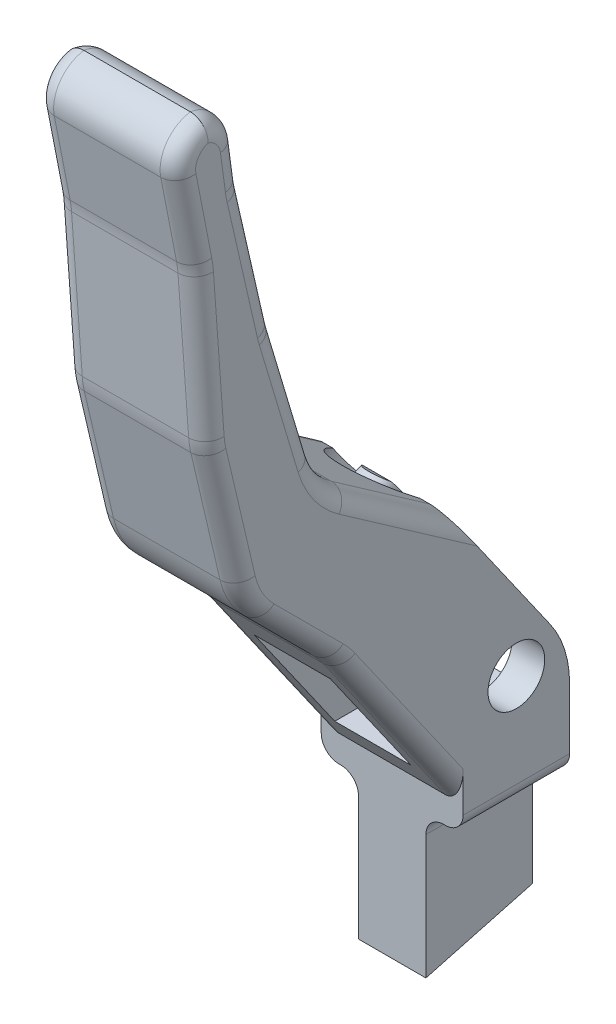
from build123d import *

# Parameters (mm, degrees)
BOSS_EXTRUDE1_DEPTH            = 4
BOSS_EXTRUDE1_DEPTH_BACK       = 4
CUT_EXTRUDE1_DEPTH             = 41.91630483998618
CUT_EXTRUDE1_DEPTH_BACK        = 41.91630483998618
SKETCH2_W                      = 4.3
SKETCH2_H                      = 6.500000000000001
CUT_EXTRUDE2_DEPTH             = 41.91630483998618
CUT_EXTRUDE2_DEPTH_BACK        = 41.91630483998618
SKETCH3_R                      = 1.6
FILLET1_R                      = 6
SKETCH4_W                      = 2.1
SKETCH4_H                      = 6
CUT_EXTRUDE3_DEPTH             = 8
CHAMFER1_SIZE2                 = 6
CHAMFER1_SIZE                  = 1.607695155
CUT_EXTRUDE4_REACH             = 42.961
SKETCH5_R                      = 2.5000000000000013
SKETCH5_R_2                    = 1.0000000000000007
CUT_EXTRUDE4_DIRECTION_2_DEPTH = 2
FILLET2_R                      = 0.5
FILLET4_R                      = 5
FILLET5_R                      = 2
FILLET3_R                      = 1
FILLET6_R                      = 1


# Some blends are built 0.0001 mm under size
with BuildPart() as part:
    # Sketch1 → Boss-Extrude1 (new, two sides: drawn at the far end of the back side and taken through both)
    with BuildSketch(Plane(origin=(0, 0, 0), x_dir=(0, 0, -1), z_dir=(1, 0, 0)).offset(-BOSS_EXTRUDE1_DEPTH_BACK)):
        Polygon((-3.000000000000001, -4.800000000000001), (-3, -14.3), (3, -14.3), (3.0000000000000027, 0), (-3.8829172362125313, 9.829824531467917), (-10.84570961266894, 14.70522424045184), (-13.58193115320061, 23.844215950393988), (-15.378428238466466, 31.705141587860197), (-15.919640758594626, 35.74219326392616), (-19.50998776121677, 35.742193263926154), (-18.095633132633182, 28.500528392334523), (-17.441484730828904, 19.459007101196175), (-15.378428238466466, 10.64578329548253), (-10.164239956075727, 5.43159501309181), align=None)
    extrude(amount=BOSS_EXTRUDE1_DEPTH + BOSS_EXTRUDE1_DEPTH_BACK)

    # Sketch2 → Cut-Extrude1 (cut, two sides: drawn at the far end of the back side and taken through both)
    with BuildSketch(Plane.XY.offset(-CUT_EXTRUDE1_DEPTH_BACK)):
        Rectangle(SKETCH2_W, SKETCH2_H)
    extrude(amount=CUT_EXTRUDE1_DEPTH + CUT_EXTRUDE1_DEPTH_BACK, mode=Mode.SUBTRACT)

    # Sketch3 → Cut-Extrude2 (cut, two sides: drawn at the far end of the back side and taken through both)
    with BuildSketch(Plane(origin=(0, 0, 0), x_dir=(0, 0, -1), z_dir=(1, 0, 0)).offset(-CUT_EXTRUDE2_DEPTH_BACK)):
        Circle(SKETCH3_R)
    extrude(amount=CUT_EXTRUDE2_DEPTH + CUT_EXTRUDE2_DEPTH_BACK, mode=Mode.SUBTRACT)

    # Fillet1
    fillet1_edges = [part.edges().sort_by_distance(p)[0] for p in [
        (-3.0749999999999997, 0, -3.0000000000000027),
        (3.075, 0, -3.0000000000000027),
    ]]
    fillet(fillet1_edges, radius=FILLET1_R)

    # Sketch4 → Cut-Extrude3 (cut)
    with BuildSketch(Plane.XZ.offset(14.3)):
        with Locations((-2.95, 0)):
            Rectangle(SKETCH4_W, SKETCH4_H)
        with Locations((2.95, 0)):
            Rectangle(SKETCH4_W, SKETCH4_H)
    extrude(amount=-CUT_EXTRUDE3_DEPTH, mode=Mode.SUBTRACT)

    # Chamfer1
    chamfer1_edges = [part.edges().sort_by_distance(p)[0] for p in [
        (0, -14.3, -3),
    ]]
    chamfer1_side = [part.faces().sort_by_distance(p)[0] for p in [
        (0, -14.267846096908267, -3),
    ]]
    chamfer(chamfer1_edges, length=CHAMFER1_SIZE - 0.0001, length2=CHAMFER1_SIZE2 - 0.0001, reference=chamfer1_side[0])  # a hair under: the kernel refuses the full size

    # Sketch5 → Cut-Extrude4 (cut, up to next)
    with BuildSketch(Plane(origin=(0, 0.10019833493160003, -0.27529266269151886), x_dir=(1, 0, 0), z_dir=(0, -0.34202014332567265, 0.939692620785907)), mode=Mode.PRIVATE) as cut_extrude4_sk1:
        with Locations(Location((0, 10, 0), (0, 0, 13.062852968))):
            Circle(SKETCH5_R)
        with Locations(Location((0, 10, 0), (0, 0, 34.405727741))):
            Circle(SKETCH5_R_2, mode=Mode.SUBTRACT)
    cut_extrude4_tool1 = extrude(cut_extrude4_sk1.sketch, amount=-CUT_EXTRUDE4_REACH, mode=Mode.PRIVATE) & part.part
    add(cut_extrude4_tool1.solids().sort_by_distance((-2.366426, 8.98117, 2.957117))[0], mode=Mode.SUBTRACT)

    # Sketch5 → Cut-Extrude4 direction 2 (cut)
    with BuildSketch(Plane(origin=(0, 0.10019833493160003, -0.27529266269151886), x_dir=(1, 0, 0), z_dir=(0, -0.34202014332567265, 0.939692620785907))):
        with Locations(Location((0, 10, 0), (0, 0, 13.062852968))):
            Circle(SKETCH5_R)
        with Locations(Location((0, 10, 0), (0, 0, 34.405727741))):
            Circle(SKETCH5_R_2, mode=Mode.SUBTRACT)
    extrude(amount=CUT_EXTRUDE4_DIRECTION_2_DEPTH, mode=Mode.SUBTRACT)

    # Fillet2
    fillet2_edges = [part.edges().sort_by_distance(p)[0] for p in [
        (4.4e-16, 3.25, -0.7243255008184559),
    ]]
    fillet(fillet2_edges, radius=FILLET2_R)

    # Fillet4
    # the kernel refuses this fillet: 5 mm, written as the material it adds along each edge
    with BuildSketch(Plane(origin=(4, 5.43159501309181, 10.164239956075727), x_dir=(0, 0.7071067811865465, 0.7071067811865486), z_dir=(-1, 0, 0))) as fillet4_piece_1:
        with BuildLine():
            CenterArc((FILLET4_R * 0.0874886635259, -FILLET4_R), FILLET4_R, 89.99999999999997, 10.000000000000199)
            Line((-FILLET4_R * 0.086159514141, -FILLET4_R * 0.0151922469878), (0, 0))
            Line((0, 0), (FILLET4_R * 0.0874886635259, 2e-17))
        make_face()
    extrude(amount=8)
    with BuildSketch(Plane(origin=(-4, 28.500528392334523, 18.095633132633182), x_dir=(0, 0.9814562655585333, 0.19168619876219029), z_dir=(1, 0, 0))) as fillet4_piece_2:
        with BuildLine():
            CenterArc((FILLET4_R * 0.0604014869533, FILLET4_R), FILLET4_R, 263.08689839308795, 6.913101606911994)
            Line((-FILLET4_R * 0.0599623587654, FILLET4_R * 0.00727015525684), (0, 0))
            Line((0, 0), (FILLET4_R * 0.0604014869533, -1e-17))
        make_face()
    extrude(amount=8)
    with BuildSketch(Plane(origin=(-4, 31.705141587860197, 15.378428238466466), x_dir=(0, -0.9748662082340892, -0.22279110404881375), z_dir=(1, 0, 0))) as fillet4_piece_3:
        with BuildLine():
            CenterArc((FILLET4_R * 0.0457367799451, FILLET4_R), FILLET4_R, 264.762601002661, 5.237398997338971)
            Line((-FILLET4_R * 0.0455458301397, FILLET4_R * 0.00417497265026), (0, 0))
            Line((0, 0), (FILLET4_R * 0.0457367799451, 0))
        make_face()
    extrude(amount=8)
    with BuildSketch(Plane(origin=(-4, 23.844215950393988, 13.58193115320061), x_dir=(0, -0.9579841255207325, -0.28682122524366543), z_dir=(1, 0, 0))) as fillet4_piece_4:
        with BuildLine():
            CenterArc((FILLET4_R * 0.0331273043115, FILLET4_R), FILLET4_R, 266.20527827895825, 3.794721721041242)
            Line((-FILLET4_R * 0.0330546749969, FILLET4_R * 0.00219243056848), (0, 0))
            Line((0, 0), (FILLET4_R * 0.0331273043115, 0))
        make_face()
    extrude(amount=8)
    with BuildSketch(Plane(origin=(-4, 14.70522424045184, 10.84570961266894), x_dir=(0, -0.5735764363510492, -0.8191520442889896), z_dir=(1, 0, 0))) as fillet4_piece_5:
        with BuildLine():
            CenterArc((FILLET4_R * 0.347574122955, FILLET4_R), FILLET4_R, 231.66774277351772, 38.332257226482284)
            Line((-FILLET4_R * 0.272646635616, FILLET4_R * 0.215572686199), (0, 0))
            Line((0, 0), (FILLET4_R * 0.347574122955, -7e-17))
        make_face()
    extrude(amount=8)
    # the kernel refuses this fillet: 5 mm, written as the material it takes off along each edge
    with BuildSketch(Plane(origin=(7.563674379485587, 10.64578329548253, 15.378428238466466), x_dir=(0, -0.7071067811865464, -0.7071067811865488), z_dir=(-1, 0, 0))) as fillet4_2_piece_1:
        with BuildLine():
            CenterArc((FILLET4_R * 0.285093950359, -FILLET4_R), FILLET4_R, 90.00000000000001, 31.825060763139305)
            Line((-FILLET4_R * 0.242233531689, -FILLET4_R * 0.15033787499), (0, 0))
            Line((0, 0), (FILLET4_R * 0.285093950359, -2e-17))
        make_face()
    extrude(amount=15.127348758971173, mode=Mode.SUBTRACT)
    with BuildSketch(Plane(origin=(-4.987814470464539, 19.459007101196175, 17.441484730828904), x_dir=(0, -0.973678688774351, -0.22792501184964434), z_dir=(1, 0, 0))) as fillet4_2_piece_2:
        with BuildLine():
            CenterArc((FILLET4_R * 0.0790251576372, FILLET4_R), FILLET4_R, 260.9631643644952, 9.036835635504929)
            Line((-FILLET4_R * 0.0780442629476, FILLET4_R * 0.0124124357217), (0, 0))
            Line((0, 0), (FILLET4_R * 0.0790251576372, 0))
        make_face()
    extrude(amount=9.975628940929077, mode=Mode.SUBTRACT)

    # Fillet5
    # the kernel refuses this fillet: 2 mm, written as the material it takes off along each edge
    with BuildSketch(Plane(origin=(-8.374424360751373, 35.74219326392616, 15.919640758594626), x_dir=(0, -0.9911331219582963, -0.1328726253116156), z_dir=(1, 0, 0))) as fillet5_piece_1:
        with BuildLine():
            CenterArc((FILLET5_R * 0.87488487215, -FILLET5_R), FILLET5_R, 90.00000000000006, 82.3643779448629)
            Line((-FILLET5_R * 0.116248249808, -FILLET5_R * 0.867127374688), (0, 0))
            Line((0, 0), (FILLET5_R * 0.87488487215, 2e-17))
        make_face()
    extrude(amount=16.748848721502746, mode=Mode.SUBTRACT)
    with BuildSketch(Plane(origin=(-10.071010194652018, 35.742193263926154, 19.50998776121677), x_dir=(0, 2.93e-15, -1), z_dir=(1, 0, 0))) as fillet5_piece_2:
        with BuildLine():
            CenterArc((FILLET5_R * 1.21420203893, -FILLET5_R), FILLET5_R, 89.99999999999993, 101.05120520826807)
            Line((FILLET5_R * 0.232745773372, -FILLET5_R * 1.19168619876), (0, 0))
            Line((0, 0), (FILLET5_R * 1.21420203893, 0))
        make_face()
    extrude(amount=20.142020389304037, mode=Mode.SUBTRACT)

    # Fillet3
    fillet3_edges = [part.edges().sort_by_distance(p)[0] for p in [
        (-4, -6.300000000000001, 0),
        (-1.9, -6.300000000000001, 0),
        (4, -6.300000000000001, 0),
        (1.9, -6.300000000000001, 0),
    ]]
    fillet(fillet3_edges, radius=FILLET3_R)

    # Fillet6
    # the kernel refuses this fillet: 1 mm, written as the material it takes off along each edge
    with BuildSketch(Plane(origin=(-4, 7.392124676975955, 0.40152104798432475), x_dir=(0, -0.8191520442889894, 0.5735764363510496), z_dir=(0, 0.5735764363510496, 0.8191520442889894))) as fillet6_piece_1:
        with BuildLine():
            CenterArc((FILLET6_R, FILLET6_R), FILLET6_R, 180, 90)
            Line((9.5e-16, FILLET6_R), (0, 0))
            Line((0, 0), (FILLET6_R, 0))
        make_face()
    extrude(amount=11.012129385225144, mode=Mode.SUBTRACT)
    with BuildSketch(Plane(origin=(4, 28.199308286666977, 18.07384004667243), x_dir=(-1, -2.6e-16, 3.53e-15), z_dir=(0, -0.9973930141843592, -0.07216075980918318))) as fillet6_piece_2:
        with BuildLine():
            CenterArc((FILLET6_R, FILLET6_R), FILLET6_R, 180.00000000000017, 90)
            Line((-3.54e-15, FILLET6_R), (0, 0))
            Line((0, 0), (FILLET6_R, 0))
        make_face()
    extrude(amount=8.368020796130923, mode=Mode.SUBTRACT)
    with BuildSketch(Plane(origin=(-4, 28.199308286666977, 18.07384004667243), x_dir=(0, 0.07216075980918318, -0.9973930141843592), z_dir=(0, -0.9973930141843592, -0.07216075980918318))) as fillet6_piece_3:
        with BuildLine():
            CenterArc((FILLET6_R, FILLET6_R), FILLET6_R, 180, 90)
            Line((0, FILLET6_R), (0, 0))
            Line((0, 0), (FILLET6_R, 0))
        make_face()
    extrude(amount=8.368020796130923, mode=Mode.SUBTRACT)
    with BuildSketch(Plane(origin=(4, 24.00568939810992, 13.61883349670923), x_dir=(-1, -1.8e-16, 7.7e-16), z_dir=(0, 0.9748662082340894, 0.22279110404881328))) as fillet6_piece_4:
        with BuildLine():
            CenterArc((FILLET6_R, FILLET6_R), FILLET6_R, 179.99999999999986, 90.00000000000011)
            Line((7.9e-16, FILLET6_R), (0, 0))
            Line((0, 0), (FILLET6_R, 0))
        make_face()
    extrude(amount=7.6692739171702975, mode=Mode.SUBTRACT)
    with BuildSketch(Plane(origin=(-4, 24.00568939810992, 13.61883349670923), x_dir=(0, -0.22279110404881328, 0.9748662082340895), z_dir=(0, 0.9748662082340894, 0.22279110404881328))) as fillet6_piece_5:
        with BuildLine():
            CenterArc((FILLET6_R, FILLET6_R), FILLET6_R, 180, 90)
            Line((2.52e-15, FILLET6_R), (0, 0))
            Line((0, 0), (FILLET6_R, 0))
        make_face()
    extrude(amount=7.6692739171702975, mode=Mode.SUBTRACT)
    with BuildSketch(Plane(origin=(4, 31.931797775336367, 15.408814068589443), x_dir=(-1, 4.7e-16, -3.49e-15), z_dir=(0, 0.9911331219582964, 0.13287262531161528))) as fillet6_piece_6:
        with BuildLine():
            CenterArc((FILLET6_R, FILLET6_R), FILLET6_R, 179.99999999999986, 90.00000000000034)
            Line((-3.52e-15, FILLET6_R), (0, 0))
            Line((0, 0), (FILLET6_R, 0))
        make_face()
    extrude(amount=2.094714315581929, mode=Mode.SUBTRACT)
    with BuildSketch(Plane(origin=(-4, 31.931797775336367, 15.408814068589443), x_dir=(0, -0.13287262531161528, 0.9911331219582964), z_dir=(0, 0.9911331219582964, 0.13287262531161528))) as fillet6_piece_7:
        with BuildLine():
            CenterArc((FILLET6_R, FILLET6_R), FILLET6_R, 180, 90)
            Line((0, FILLET6_R), (0, 0))
            Line((0, 0), (FILLET6_R, 0))
        make_face()
    extrude(amount=2.094714315581929, mode=Mode.SUBTRACT)
    with BuildSketch(Plane(origin=(4, 16.37007670161563, 11.344167791713767), x_dir=(-1, -2.9e-16, 9.8e-16), z_dir=(0, 0.9579841255207351, 0.2868212252436569))) as fillet6_piece_8:
        with BuildLine():
            CenterArc((FILLET6_R, FILLET6_R), FILLET6_R, 179.99999999999986, 90.00000000000011)
            Line((1.02e-15, FILLET6_R), (0, 0))
            Line((0, 0), (FILLET6_R, 0))
        make_face()
    extrude(amount=7.636308259850825, mode=Mode.SUBTRACT)
    with BuildSketch(Plane(origin=(-4, 16.37007670161563, 11.344167791713767), x_dir=(0, -0.28682122524365694, 0.9579841255207351), z_dir=(0, 0.9579841255207351, 0.2868212252436569))) as fillet6_piece_9:
        with BuildLine():
            CenterArc((FILLET6_R, FILLET6_R), FILLET6_R, 180, 90)
            Line((2.72e-15, FILLET6_R), (0, 0))
            Line((0, 0), (FILLET6_R, 0))
        make_face()
    extrude(amount=7.636308259850825, mode=Mode.SUBTRACT)
    with BuildSketch(Plane(origin=(4, 19.074281541854155, 17.351425680874474), x_dir=(-1, 1.8e-16, -7.9e-16), z_dir=(0, -0.9736786887743505, -0.2279250118496466))) as fillet6_piece_10:
        with BuildLine():
            CenterArc((FILLET6_R, FILLET6_R), FILLET6_R, 180, 89.99999999999994)
            Line((8.1e-16, FILLET6_R), (0, 0))
            Line((0, 0), (FILLET6_R, 0))
        make_face()
    extrude(amount=7.23087483451074, mode=Mode.SUBTRACT)
    with BuildSketch(Plane(origin=(-4, 19.074281541854155, 17.351425680874474), x_dir=(0, 0.2279250118496466, -0.9736786887743504), z_dir=(0, -0.9736786887743505, -0.2279250118496466))) as fillet6_piece_11:
        with BuildLine():
            CenterArc((FILLET6_R, FILLET6_R), FILLET6_R, 180, 90)
            Line((8.1e-16, FILLET6_R), (0, 0))
            Line((0, 0), (FILLET6_R, 0))
        make_face()
    extrude(amount=7.23087483451074, mode=Mode.SUBTRACT)
    with BuildSketch(Plane(origin=(4, 9.637823967611984, 14.370468910595916), x_dir=(-1, 0, 0), z_dir=(0, -0.7071067811865464, -0.7071067811865488))) as fillet6_piece_12:
        with BuildLine():
            CenterArc((FILLET6_R, FILLET6_R), FILLET6_R, 180, 90)
            Line((0, FILLET6_R), (0, 0))
            Line((0, 0), (FILLET6_R, 0))
        make_face()
    extrude(amount=5.511062716299017, mode=Mode.SUBTRACT)
    with BuildSketch(Plane(origin=(4, 5.073262425195165, 9.913332776844305), x_dir=(-1, 0, 0), z_dir=(0, -0.8191520442889931, -0.5735764363510443))) as fillet6_piece_13_section:
        with BuildLine():
            CenterArc((FILLET6_R, FILLET6_R), FILLET6_R, 180.00000000000006, 89.99999999999994)
            Line((0, FILLET6_R), (0, 0))
            Line((0, 0), (FILLET6_R, 0))
        make_face()
    fillet6_piece_13 = extrude(amount=14.553027876851548, mode=Mode.PRIVATE)
    fillet6_piece_13 = split(fillet6_piece_13, bisect_by=Plane(origin=(4, 5.073262425195166, 3.0000000000000018), z_dir=(0, -9e-17, 1)), keep=Keep.TOP, mode=Mode.PRIVATE)
    add(fillet6_piece_13, mode=Mode.SUBTRACT)
    with BuildSketch(Plane(origin=(4.000000000000001, 20.21390660110446, 12.483032237003172), x_dir=(0, -0.22792501185005917, 0.9736786887742539), z_dir=(0, -0.9736786887742539, -0.22792501185005917))) as fillet6_piece_14:
        with BuildLine():
            CenterArc((5.0000000000000036 - FILLET6_R, FILLET6_R), FILLET6_R, 270.0000000000002, 89.99999999999977)
            Line((5.0000000000000036 - FILLET6_R, 0), (5.0000000000000036, 0))
            Line((5.0000000000000036, 0), (5, FILLET6_R))
        make_face()
    revolve(axis=Axis((4.000000000000001, 20.21390660110446, 12.483032237003172), (-1, 0, 0)), revolution_arc=9.036835635504966, mode=Mode.SUBTRACT)
    with BuildSketch(Plane(origin=(4, 13.17335787354519, 10.834935004662714), x_dir=(0, -0.2279250118496492, 0.9736786887743498), z_dir=(0, 0.9736786887743498, 0.2279250118496492))) as fillet6_piece_15:
        with BuildLine():
            CenterArc((4.999999999999999 - FILLET6_R, -FILLET6_R), FILLET6_R, 0, 89.99999999999994)
            Line((4.999999999999999 - FILLET6_R, 0), (4.999999999999999, 0))
            Line((4.999999999999999, 0), (5, -FILLET6_R))
        make_face()
    revolve(axis=Axis((4, 13.17335787354519, 10.834935004662714), (1, 0, 0)), revolution_arc=31.825060763138996, mode=Mode.SUBTRACT)
    with BuildSketch(Plane(origin=(-4, 9.637823967611984, 14.370468910595916), x_dir=(0, 0.7071067811865488, -0.7071067811865464), z_dir=(0, -0.7071067811865464, -0.7071067811865488))) as fillet6_piece_16:
        with BuildLine():
            CenterArc((FILLET6_R, FILLET6_R), FILLET6_R, 180, 90)
            Line((0, FILLET6_R), (0, 0))
            Line((0, 0), (FILLET6_R, 0))
        make_face()
    extrude(amount=5.511062716299017, mode=Mode.SUBTRACT)
    with BuildSketch(Plane(origin=(-4, 5.073262425195165, 9.913332776844305), x_dir=(0, 0.5735764363510443, -0.8191520442889931), z_dir=(0, -0.8191520442889931, -0.5735764363510443))) as fillet6_piece_17_section:
        with BuildLine():
            CenterArc((FILLET6_R, FILLET6_R), FILLET6_R, 180, 90)
            Line((-1.96e-15, FILLET6_R), (0, 0))
            Line((0, 0), (FILLET6_R, 0))
        make_face()
    fillet6_piece_17 = extrude(amount=14.553027876851548, mode=Mode.PRIVATE)
    fillet6_piece_17 = split(fillet6_piece_17, bisect_by=Plane(origin=(-4, 5.073262425195166, 3.0000000000000018), z_dir=(0, -9e-17, 1)), keep=Keep.TOP, mode=Mode.PRIVATE)
    add(fillet6_piece_17, mode=Mode.SUBTRACT)
    with BuildSketch(Plane(origin=(-4, 20.21390660110446, 12.483032237003172), x_dir=(0, -0.22792501185005917, 0.9736786887742539), z_dir=(0, -0.9736786887742539, -0.22792501185005917))) as fillet6_piece_18:
        with BuildLine():
            CenterArc((5.0000000000000036 - FILLET6_R, -FILLET6_R), FILLET6_R, 0, 90)
            Line((5.0000000000000036, -FILLET6_R), (5.0000000000000036, 0))
            Line((5.0000000000000036, 0), (5.0000000000000036 - FILLET6_R, 0))
        make_face()
    revolve(axis=Axis((-4, 20.21390660110446, 12.483032237003172), (-1, 0, 0)), revolution_arc=9.036835635504966, mode=Mode.SUBTRACT)
    with BuildSketch(Plane(origin=(-3.999999999999999, 13.17335787354519, 10.834935004662714), x_dir=(0, -0.2279250118496492, 0.9736786887743498), z_dir=(0, 0.9736786887743498, 0.2279250118496492))) as fillet6_piece_19:
        with BuildLine():
            CenterArc((4.999999999999999 - FILLET6_R, FILLET6_R), FILLET6_R, 270, 90.00000000000006)
            Line((5.0000000000000036, FILLET6_R), (4.999999999999999, 0))
            Line((4.999999999999999, 0), (4.999999999999999 - FILLET6_R, -8.9e-16))
        make_face()
    revolve(axis=Axis((-3.999999999999999, 13.17335787354519, 10.834935004662714), (1, 0, 0)), revolution_arc=31.825060763138996, mode=Mode.SUBTRACT)
    with BuildSketch(Plane(origin=(4, 27.83850448762226, 23.06080511759416), x_dir=(0, 0.07216075980890861, -0.9973930141843791), z_dir=(0, -0.9973930141843791, -0.07216075980890861))) as fillet6_piece_20:
        with BuildLine():
            CenterArc((4.999999999999998 + FILLET6_R, -FILLET6_R), FILLET6_R, 89.99999999999994, 90.00000000000006)
            Line((4.999999999999998 + FILLET6_R, 0), (4.999999999999998, 0))
            Line((4.999999999999998, 0), (4.999999999999998, -FILLET6_R))
        make_face()
    revolve(axis=Axis((4, 27.83850448762226, 23.06080511759416), (1, 0, 0)), revolution_arc=6.913101606911969, mode=Mode.SUBTRACT)
    with BuildSketch(Plane(origin=(-4, 27.83850448762226, 23.06080511759416), x_dir=(0, 0.07216075980890861, -0.9973930141843791), z_dir=(0, -0.9973930141843791, -0.07216075980890861))) as fillet6_piece_21:
        with BuildLine():
            CenterArc((4.999999999999998 + FILLET6_R, FILLET6_R), FILLET6_R, 180, 90)
            Line((4.999999999999998, FILLET6_R), (4.999999999999998, 0))
            Line((4.999999999999998, 0), (4.999999999999998 + FILLET6_R, 0))
        make_face()
    revolve(axis=Axis((-4, 27.83850448762226, 23.06080511759416), (1, 0, 0)), revolution_arc=6.913101606911969, mode=Mode.SUBTRACT)
    with BuildSketch(Plane(origin=(4, 32.59616090189547, 10.453148458797703), x_dir=(0, -0.13287262531181343, 0.9911331219582697), z_dir=(0, 0.9911331219582697, 0.13287262531181343))) as fillet6_piece_22:
        with BuildLine():
            CenterArc((4.999999999999997 + FILLET6_R, -FILLET6_R), FILLET6_R, 90.0000000000002, 89.99999999999977)
            Line((4.999999999999997 + FILLET6_R, 0), (4.999999999999997, 0))
            Line((4.999999999999997, 0), (5.000000000000001, -FILLET6_R))
        make_face()
    revolve(axis=Axis((4, 32.59616090189547, 10.453148458797703), (1, 0, 0)), revolution_arc=5.237398997339021, mode=Mode.SUBTRACT)
    with BuildSketch(Plane(origin=(-4, 32.59616090189547, 10.453148458797703), x_dir=(0, -0.13287262531181343, 0.9911331219582697), z_dir=(0, 0.9911331219582697, 0.13287262531181343))) as fillet6_piece_23:
        with BuildLine():
            CenterArc((4.999999999999997 + FILLET6_R, FILLET6_R), FILLET6_R, 180, 90)
            Line((4.999999999999997, FILLET6_R), (4.999999999999997, 0))
            Line((4.999999999999997, 0), (4.999999999999997 + FILLET6_R, 0))
        make_face()
    revolve(axis=Axis((-4, 32.59616090189547, 10.453148458797703), (1, 0, 0)), revolution_arc=5.237398997339021, mode=Mode.SUBTRACT)
    with BuildSketch(Plane(origin=(4, 25.119644918354947, 8.744502455539427), x_dir=(0, -0.22279110404904903, 0.9748662082340355), z_dir=(0, 0.9748662082340355, 0.22279110404904903))) as fillet6_piece_24:
        with BuildLine():
            CenterArc((4.999999999999999 + FILLET6_R, -FILLET6_R), FILLET6_R, 89.9999999999998, 90.00000000000023)
            Line((4.999999999999999 + FILLET6_R, 0), (4.999999999999999, 0))
            Line((4.999999999999999, 0), (4.999999999999998, -FILLET6_R))
        make_face()
    revolve(axis=Axis((4, 25.119644918354947, 8.744502455539427), (1, 0, 0)), revolution_arc=3.794721721040992, mode=Mode.SUBTRACT)
    with BuildSketch(Plane(origin=(-4, 25.119644918354947, 8.744502455539427), x_dir=(0, -0.22279110404904903, 0.9748662082340355), z_dir=(0, 0.9748662082340355, 0.22279110404904903))) as fillet6_piece_25:
        with BuildLine():
            CenterArc((4.999999999999999 + FILLET6_R, FILLET6_R), FILLET6_R, 180, 90)
            Line((5, FILLET6_R), (4.999999999999999, 0))
            Line((4.999999999999999, 0), (4.999999999999999 + FILLET6_R, 0))
        make_face()
    revolve(axis=Axis((-4, 25.119644918354947, 8.744502455539427), (1, 0, 0)), revolution_arc=3.794721721040992, mode=Mode.SUBTRACT)
    with BuildSketch(Plane(origin=(4, 17.804182827835298, 6.554247164111192), x_dir=(0, -0.2868212252437068, 0.9579841255207201), z_dir=(0, 0.9579841255207201, 0.2868212252437068))) as fillet6_piece_26:
        with BuildLine():
            CenterArc((5.000000000000001 + FILLET6_R, -FILLET6_R), FILLET6_R, 89.9999999999999, 90.00000000000011)
            Line((5.000000000000001 + FILLET6_R, 0), (5.000000000000001, 0))
            Line((5.000000000000001, 0), (4.999999999999999, -FILLET6_R))
        make_face()
    revolve(axis=Axis((4, 17.804182827835298, 6.554247164111192), (1, 0, 0)), revolution_arc=38.33225722648201, mode=Mode.SUBTRACT)
    with BuildSketch(Plane(origin=(-4, 17.804182827835298, 6.554247164111192), x_dir=(0, -0.2868212252437068, 0.9579841255207201), z_dir=(0, 0.9579841255207201, 0.2868212252437068))) as fillet6_piece_27:
        with BuildLine():
            CenterArc((5.000000000000001 + FILLET6_R, FILLET6_R), FILLET6_R, 180, 90)
            Line((5.000000000000003, FILLET6_R), (5.000000000000001, 0))
            Line((5.000000000000001, 0), (5.000000000000001 + FILLET6_R, 0))
        make_face()
    revolve(axis=Axis((-4, 17.804182827835298, 6.554247164111192), (1, 0, 0)), revolution_arc=38.33225722648201, mode=Mode.SUBTRACT)
    with BuildSketch(Plane(origin=(4, 2.205380243439823, 14.009092998289299), x_dir=(0, 0.7071067811865476, -0.7071067811865476), z_dir=(0, 0.7071067811865476, 0.7071067811865476))) as fillet6_piece_28:
        with BuildLine():
            CenterArc((5.000000000000001 + FILLET6_R, FILLET6_R), FILLET6_R, 180, 89.99999999999994)
            Line((5.000000000000001 + FILLET6_R, 0), (5.000000000000001, 0))
            Line((5.000000000000001, 0), (5.000000000000001, FILLET6_R))
        make_face()
    revolve(axis=Axis((4, 2.205380243439823, 14.009092998289299), (-1, 0, 0)), revolution_arc=10.000000000000002, mode=Mode.SUBTRACT)
    with BuildSketch(Plane(origin=(-4, 2.205380243439823, 14.009092998289299), x_dir=(0, 0.7071067811865476, -0.7071067811865476), z_dir=(0, 0.7071067811865476, 0.7071067811865476))) as fillet6_piece_29:
        with BuildLine():
            CenterArc((5.000000000000001 + FILLET6_R, -FILLET6_R), FILLET6_R, 90, 90)
            Line((5.000000000000001, -FILLET6_R), (5.000000000000001, 0))
            Line((5.000000000000001, 0), (5.000000000000001 + FILLET6_R, 0))
        make_face()
    revolve(axis=Axis((-4, 2.205380243439823, 14.009092998289299), (-1, 0, 0)), revolution_arc=10.000000000000002, mode=Mode.SUBTRACT)
    with BuildSketch(Plane(origin=(4, 33.358820866403825, 19.044496214473433), x_dir=(-1, -2.6e-16, 1.34e-15), z_dir=(0, -0.9814562655585335, -0.19168619876218898))) as fillet6_piece_30:
        with BuildLine():
            CenterArc((FILLET6_R, FILLET6_R), FILLET6_R, 179.99999999999991, 90.00000000000017)
            Line((-1.36e-15, FILLET6_R), (0, 0))
            Line((0, 0), (FILLET6_R, 0))
        make_face()
    extrude(amount=4.648078111127988, mode=Mode.SUBTRACT)
    with BuildSketch(Plane(origin=(4, 33.742193263926, 17.081583683357003), x_dir=(0, -0.1916861987621914, 0.981456265558533), z_dir=(0, -0.981456265558533, -0.1916861987621914))) as fillet6_piece_31:
        with BuildLine():
            CenterArc((1.9999999999999967 - FILLET6_R, FILLET6_R), FILLET6_R, 269.9999999999998, 90.00000000000023)
            Line((1.9999999999999967 - FILLET6_R, 0), (1.9999999999999967, 0))
            Line((1.9999999999999967, 0), (1.9999999999999967, FILLET6_R))
        make_face()
    revolve(axis=Axis((4, 33.742193263926, 17.081583683357003), (-1, 0, 0)), revolution_arc=164.25078291404816, mode=Mode.SUBTRACT)
    with BuildSketch(Plane(origin=(4, 33.7421932639258, 17.669410502894777), x_dir=(0, 0.4510563219916968, 0.8924954870425524), z_dir=(0, -0.8924954870425524, 0.4510563219916968))) as fillet6_piece_32:
        with BuildLine():
            CenterArc((2 - FILLET6_R, FILLET6_R), FILLET6_R, 269.99999999999966, 90.00000000000034)
            Line((2 - FILLET6_R, 0), (2, 0))
            Line((2, 0), (2.000000000000003, FILLET6_R))
        make_face()
    revolve(axis=Axis((4, 33.7421932639258, 17.669410502894777), (-1, 0, 0)), revolution_arc=145.5529012529817, mode=Mode.SUBTRACT)
    with BuildSketch(Plane(origin=(-4, 33.358820866403825, 19.044496214473433), x_dir=(0, 0.19168619876218898, -0.9814562655585335), z_dir=(0, -0.9814562655585335, -0.19168619876218898))) as fillet6_piece_33:
        with BuildLine():
            CenterArc((FILLET6_R, FILLET6_R), FILLET6_R, 180, 90)
            Line((2.12e-15, FILLET6_R), (0, 0))
            Line((0, 0), (FILLET6_R, 0))
        make_face()
    extrude(amount=4.648078111127988, mode=Mode.SUBTRACT)
    with BuildSketch(Plane(origin=(-4, 33.742193263926, 17.081583683357003), x_dir=(0, -0.1916861987621914, 0.981456265558533), z_dir=(0, -0.981456265558533, -0.1916861987621914))) as fillet6_piece_34:
        with BuildLine():
            CenterArc((1.9999999999999967 - FILLET6_R, -FILLET6_R), FILLET6_R, 0, 90)
            Line((1.9999999999999967, -FILLET6_R), (1.9999999999999967, 0))
            Line((1.9999999999999967, 0), (1.9999999999999967 - FILLET6_R, 0))
        make_face()
    revolve(axis=Axis((-4, 33.742193263926, 17.081583683357003), (-1, 0, 0)), revolution_arc=164.25078291404816, mode=Mode.SUBTRACT)
    with BuildSketch(Plane(origin=(-4, 33.7421932639258, 17.669410502894777), x_dir=(0, 0.4510563219916968, 0.8924954870425524), z_dir=(0, -0.8924954870425524, 0.4510563219916968))) as fillet6_piece_35:
        with BuildLine():
            CenterArc((2 - FILLET6_R, -FILLET6_R), FILLET6_R, 0, 90)
            Line((1.9999999999999938, -FILLET6_R), (2, 0))
            Line((2, 0), (2 - FILLET6_R, 0))
        make_face()
    revolve(axis=Axis((-4, 33.7421932639258, 17.669410502894777), (-1, 0, 0)), revolution_arc=145.5529012529817, mode=Mode.SUBTRACT)
    with BuildSketch(Plane(origin=(4, 7.392124676975955, 0.40152104798432475), x_dir=(-1, -1.19e-15, 8.3e-16), z_dir=(0, 0.5735764363510496, 0.8191520442889894))) as fillet6_piece_36:
        with BuildLine():
            CenterArc((FILLET6_R, FILLET6_R), FILLET6_R, 179.99999999999997, 89.99999999999994)
            Line((1.46e-15, FILLET6_R), (0, 0))
            Line((0, 0), (FILLET6_R, 0))
        make_face()
    extrude(amount=11.012129385225144, mode=Mode.SUBTRACT)


solid = part.part
